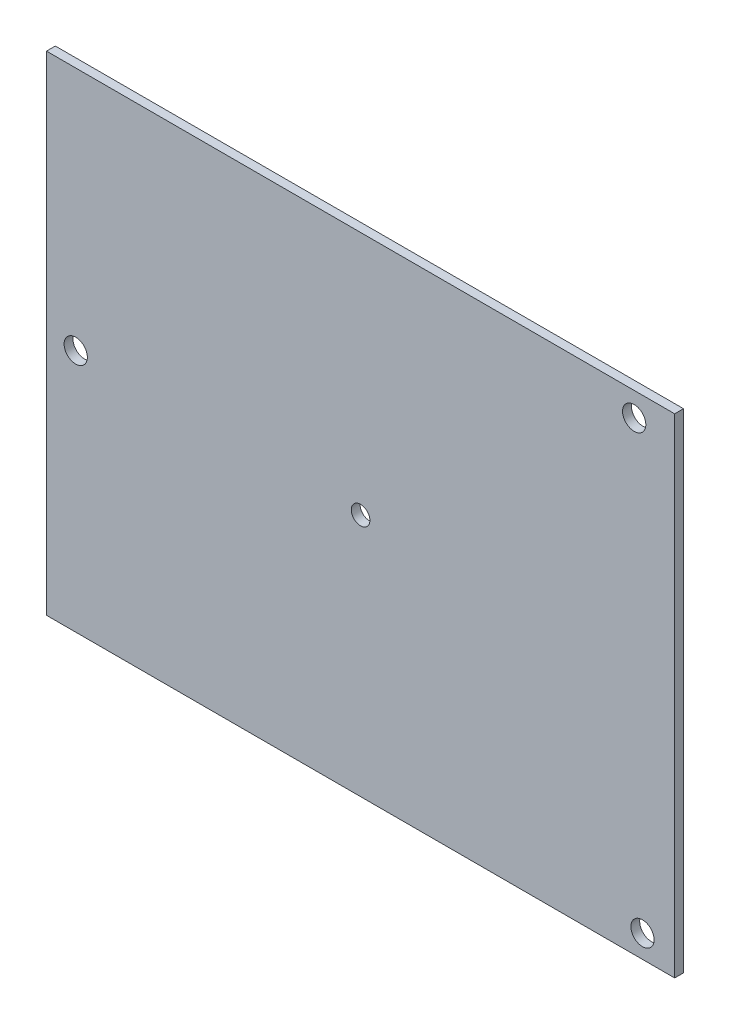
from build123d import *

# Parameters (mm, degrees)
SKETCH1_W          = 135
SKETCH1_H          = 105
BASE_FLANGE1_DEPTH = 1.89738
SKETCH6_R          = 2.5
SKETCH6_R_2        = 2
CUT_EXTRUDE1_DEPTH = 2


# Sheet-metal steps are written as plain solids
with BuildPart() as part:
    # Sketch1 → Base-Flange1 (new body)
    with BuildSketch(Plane.XY):
        with Locations((41.615210843, 55.542303175)):
            Rectangle(SKETCH1_W, SKETCH1_H)
    extrude(amount=-BASE_FLANGE1_DEPTH)

    # Sketch6 → Cut-Extrude1 (cut)
    with BuildSketch(Plane.XY):
        with Locations((-19.598596989, 55.438832042)):
            Circle(SKETCH6_R)
        with Locations((100.410588716, 102.91561949)):
            Circle(SKETCH6_R)
        with Locations((102.193882869, 7.915272769)):
            Circle(SKETCH6_R)
        with Locations((41.615210843, 55.438832042)):
            Circle(SKETCH6_R_2)
    extrude(amount=-CUT_EXTRUDE1_DEPTH, mode=Mode.SUBTRACT)


solid = part.part
